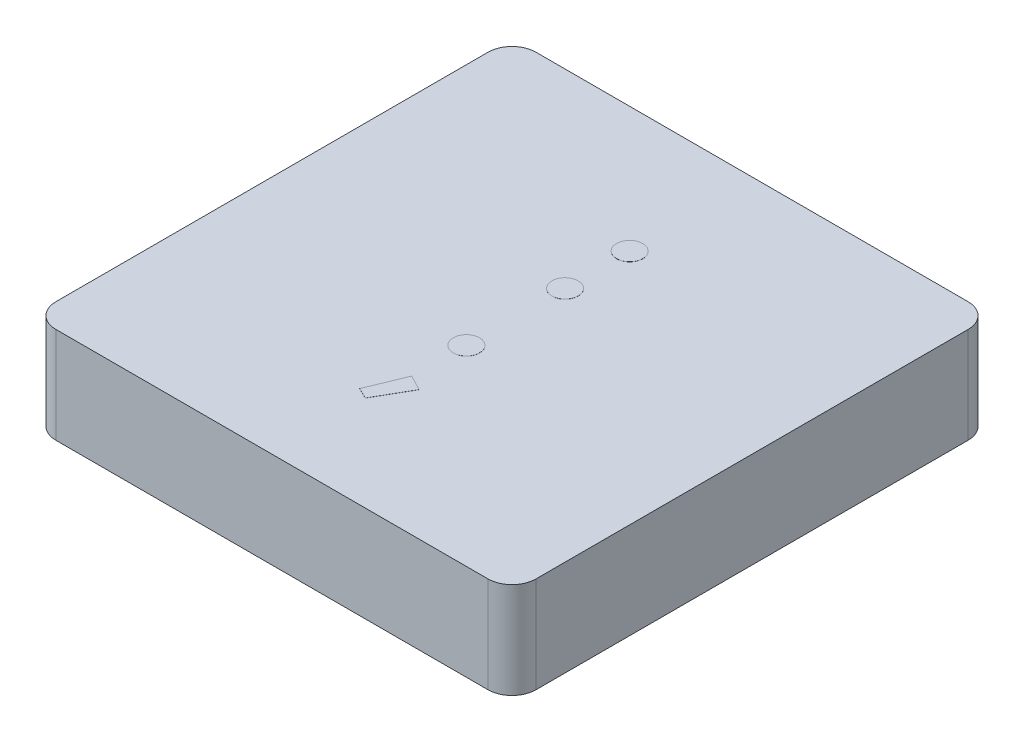
from build123d import *

# Parameters (mm, degrees)
SKETCH1_W           = 12.7
SKETCH1_H           = 12.7
BOSS_EXTRUDE1_DEPTH = 2.54
FILLET1_R           = 0.635
SHELL1_START        = 0.635
SHELL1_OUTLINE_W    = 1.905
SHELL1_OUTLINE_H    = 11.43
SHELL1_DEPTH        = 11.43
SKETCH2_R           = 2.54
BOSS_EXTRUDE2_DEPTH = 1.905
BOSS_EXTRUDE3_DEPTH = 0.00254


# Read off the part's stored shape, not the designer's step: Shell1
with BuildPart() as part:
    # Sketch1 → Boss-Extrude1 (new body)
    with BuildSketch(Plane(origin=(0, 0, 0), x_dir=(1, 0, 0), z_dir=(0, 1, 0))):
        with Locations((6.35, 6.35)):
            Rectangle(SKETCH1_W, SKETCH1_H)
    extrude(amount=BOSS_EXTRUDE1_DEPTH)

    # Fillet1
    fillet1_edges = [part.edges().sort_by_distance(p)[0] for p in [
        (0, 1.27, -12.7),
        (12.7, 1.27, -12.7),
        (12.7, 1.27, 0),
        (0, 1.27, 0),
    ]]
    fillet(fillet1_edges, radius=FILLET1_R)

    # Shell1 outline → Shell1 (cut)
    with BuildSketch(Plane.YZ.offset(SHELL1_START)):
        with Locations((0.9525, -6.35)):
            Rectangle(SHELL1_OUTLINE_W, SHELL1_OUTLINE_H)
    extrude(amount=SHELL1_DEPTH, mode=Mode.SUBTRACT)

    # Sketch2 → Boss-Extrude2 (add)
    with BuildSketch(Plane(origin=(0, 1.905, 0), x_dir=(-1, 0, 0), z_dir=(0, -1, 0))):
        with Locations(Location((-6.35, 6.35, 0), (0, 0, 270))):
            Circle(SKETCH2_R)
    extrude(amount=BOSS_EXTRUDE2_DEPTH)

    # Sketch3 → Boss-Extrude3 (add)
    with BuildSketch(Plane(origin=(0, 2.54, 0), x_dir=(1, 0, 0), z_dir=(0, 1, 0))):
        with BuildLine():
            add(Edge.make_bspline(
                [(6.432224359, 9.726897436), (6.455251183, 9.725706594), (6.500646544, 9.723358955), (6.565830657, 9.703776202), (6.625237948, 9.670782167), (6.67786071, 9.626551956), (6.722312309, 9.573817503), (6.754934047, 9.513997076), (6.774770917, 9.4485002), (6.777054423, 9.402877937), (6.778217949, 9.379631811)],
                knots=[0, 0, 0, 0, 1.013817282, 1.998651736, 2.969187861, 3.991244904, 5.013301947, 5.9920405, 6.976874954, 8, 8, 8, 8], degree=3))
            add(Edge.make_bspline(
                [(6.778217949, 9.379631811), (6.777069623, 9.356799998), (6.774815935, 9.311990578), (6.754640219, 9.247480223), (6.72234006, 9.18798217), (6.677853125, 9.135257928), (6.625239865, 9.091024972), (6.565830149, 9.058031637), (6.500646676, 9.038448699), (6.455251227, 9.036101085), (6.432224359, 9.034910256)],
                knots=[0, 0, 0, 0, 1.009116963, 1.980479832, 2.963706907, 3.990451133, 5.017195359, 5.992182391, 6.981533323, 8, 8, 8, 8], degree=3))
            add(Edge.make_bspline(
                [(6.432224359, 9.034910256), (6.409185604, 9.036078537), (6.363766721, 9.0383817), (6.298671705, 9.058314456), (6.238667642, 9.090077481), (6.186076647, 9.134036199), (6.141182927, 9.18595953), (6.109829566, 9.245948014), (6.089538882, 9.310915397), (6.087350713, 9.356368241), (6.086230769, 9.379631811)],
                knots=[0, 0, 0, 0, 1.016706445, 2.004347467, 2.981433789, 4.000427929, 5.018214116, 5.995300439, 6.973959266, 8, 8, 8, 8], degree=3))
            add(Edge.make_bspline(
                [(6.086230769, 9.379631811), (6.087378792, 9.402886411), (6.089631872, 9.448525304), (6.109660198, 9.513804333), (6.141367354, 9.574006456), (6.186018885, 9.626497828), (6.238654577, 9.671002499), (6.29850054, 9.703611102), (6.363785957, 9.723387734), (6.409192077, 9.72571628), (6.432224359, 9.726897436)],
                knots=[0, 0, 0, 0, 1.022642663, 2.007012786, 2.980863166, 4.002438329, 5.024013493, 6.00229059, 6.986660713, 8, 8, 8, 8], degree=3))
        make_face()
        with BuildLine():
            add(Edge.make_bspline(
                [(6.432224359, 8.017282051), (6.455229408, 8.01602074), (6.500522375, 8.013537435), (6.565964538, 7.995004793), (6.625026467, 7.96170826), (6.677835723, 7.918278705), (6.722489899, 7.866027151), (6.754764929, 7.806440642), (6.774863399, 7.741250637), (6.777082284, 7.695815172), (6.778217949, 7.672560497)],
                knots=[0, 0, 0, 0, 1.016957001, 2.002212695, 2.9757545, 3.99499976, 5.013036768, 5.994806404, 6.97370641, 8, 8, 8, 8], degree=3))
            add(Edge.make_bspline(
                [(6.778217949, 7.672560497), (6.777089724, 7.649302087), (6.774885374, 7.603859325), (6.754625849, 7.538542292), (6.722538129, 7.478466037), (6.67783214, 7.425654573), (6.625245168, 7.381406547), (6.565828744, 7.348417057), (6.500647041, 7.328833105), (6.45525135, 7.32648563), (6.432224359, 7.325294872)],
                knots=[0, 0, 0, 0, 1.023218912, 1.999186227, 2.986238111, 4.008388923, 5.030539734, 6.0011649, 6.986089706, 8, 8, 8, 8], degree=3))
            add(Edge.make_bspline(
                [(6.432224359, 7.325294872), (6.409191911, 7.326475947), (6.363785464, 7.328804333), (6.298502441, 7.348582131), (6.238647359, 7.381186296), (6.186047174, 7.425708246), (6.141141459, 7.478279027), (6.109966022, 7.538731843), (6.089517785, 7.603834699), (6.087343571, 7.64929375), (6.086230769, 7.672560497)],
                knots=[0, 0, 0, 0, 1.013427518, 1.99788335, 2.976245624, 3.997909735, 5.019573847, 6.001765691, 6.977268297, 8, 8, 8, 8], degree=3))
            add(Edge.make_bspline(
                [(6.086230769, 7.672560497), (6.087350912, 7.695823654), (6.089539471, 7.741275691), (6.109827339, 7.806248907), (6.141191423, 7.866215177), (6.186043429, 7.91822492), (6.238867187, 7.961926791), (6.298365885, 7.994841981), (6.363910067, 8.01356642), (6.409213828, 8.016030503), (6.432224359, 8.017282051)],
                knots=[0, 0, 0, 0, 1.025808215, 2.00424526, 2.981110158, 3.998665696, 5.017428914, 5.998734231, 6.983523959, 8, 8, 8, 8], degree=3))
        make_face()
        with BuildLine():
            add(Edge.make_bspline(
                [(6.432224359, 5.408897436), (6.455251183, 5.407706594), (6.500646544, 5.405358955), (6.565830657, 5.385776202), (6.625237948, 5.352782167), (6.67786071, 5.308551956), (6.722312309, 5.255817503), (6.754934047, 5.195997076), (6.774770917, 5.1305002), (6.777054423, 5.084877937), (6.778217949, 5.061631811)],
                knots=[0, 0, 0, 0, 1.013817282, 1.998651736, 2.969187861, 3.991244904, 5.013301947, 5.9920405, 6.976874954, 8, 8, 8, 8], degree=3))
            add(Edge.make_bspline(
                [(6.778217949, 5.061631811), (6.777082486, 5.038376721), (6.774863996, 4.992940445), (6.754762665, 4.92775631), (6.722498561, 4.868147384), (6.677802035, 4.815982727), (6.625228174, 4.772296035), (6.56565729, 4.740149638), (6.500666175, 4.720410262), (6.45525779, 4.718088149), (6.432224359, 4.716910256)],
                knots=[0, 0, 0, 0, 1.02653117, 2.005657786, 2.987654694, 4.005927372, 5.02540858, 5.994694477, 6.98280758, 8, 8, 8, 8], degree=3))
            add(Edge.make_bspline(
                [(6.432224359, 4.716910256), (6.409185604, 4.718078537), (6.363766721, 4.7203817), (6.298671705, 4.740314456), (6.238667642, 4.772077481), (6.186076647, 4.816036199), (6.141182927, 4.86795953), (6.109829566, 4.927948014), (6.089538882, 4.992915397), (6.087350713, 5.038368241), (6.086230769, 5.061631811)],
                knots=[0, 0, 0, 0, 1.016706445, 2.004347467, 2.981433789, 4.000427929, 5.018214116, 5.995300439, 6.973959266, 8, 8, 8, 8], degree=3))
            add(Edge.make_bspline(
                [(6.086230769, 5.061631811), (6.087378792, 5.084886411), (6.089631872, 5.130525304), (6.109660198, 5.195804333), (6.141367354, 5.256006456), (6.186018885, 5.308497828), (6.238654577, 5.353002499), (6.29850054, 5.385611102), (6.363785957, 5.405387734), (6.409192077, 5.40771628), (6.432224359, 5.408897436)],
                knots=[0, 0, 0, 0, 1.022642663, 2.007012786, 2.980863166, 4.002438329, 5.024013493, 6.00229059, 6.986660713, 8, 8, 8, 8], degree=3))
        make_face()
        Polygon((6.411871795, 3.636952324), (6.818923077, 3.422614383), (6.30056871, 2.518833333), (6.010544671, 2.660665264), align=None)
    extrude(amount=BOSS_EXTRUDE3_DEPTH)


solid = part.part
